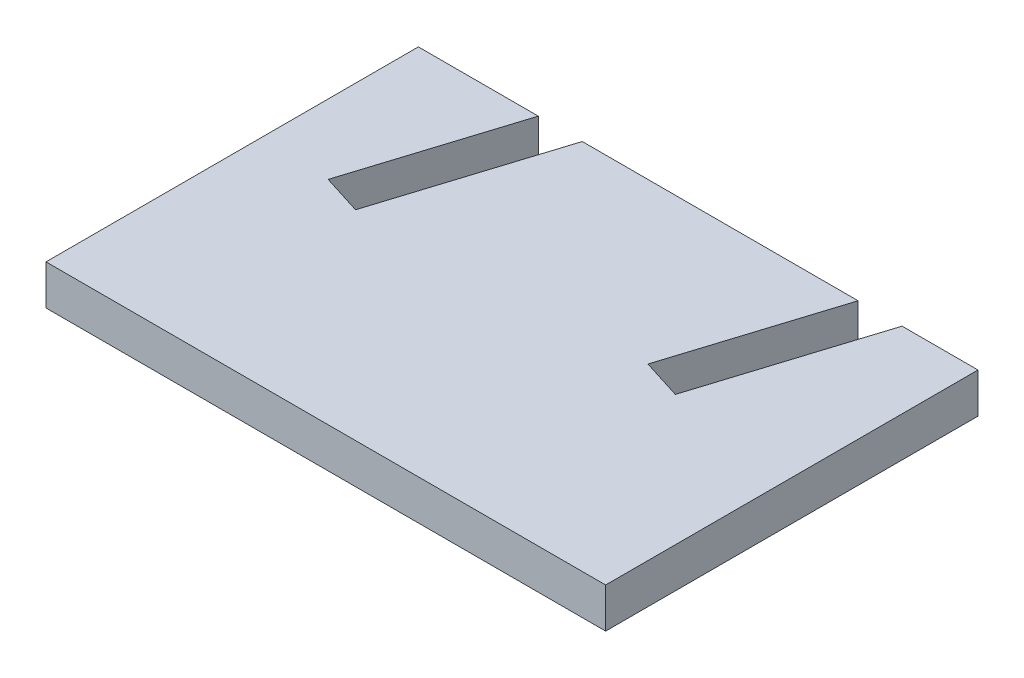
from build123d import *

# Parameters (mm, degrees)
BOSS_EXTRUDE1_DEPTH = 5


with BuildPart() as part:
    # Sketch1 → Boss-Extrude1 (new body)
    with BuildSketch(Plane(origin=(0, 0, 0), x_dir=(1, 0, 0), z_dir=(0, 1, 0))):
        Polygon((15, 46.575), (8.71029098, 26.575), (13.718471787, 25), (20.503495393, 46.575), (55, 46.575), (48.71029098, 26.575), (53.718471787, 25), (60.503495393, 46.575), (70, 46.575), (70, 0), (0, 0), (0, 46.575), align=None)
    extrude(amount=BOSS_EXTRUDE1_DEPTH)


solid = part.part
